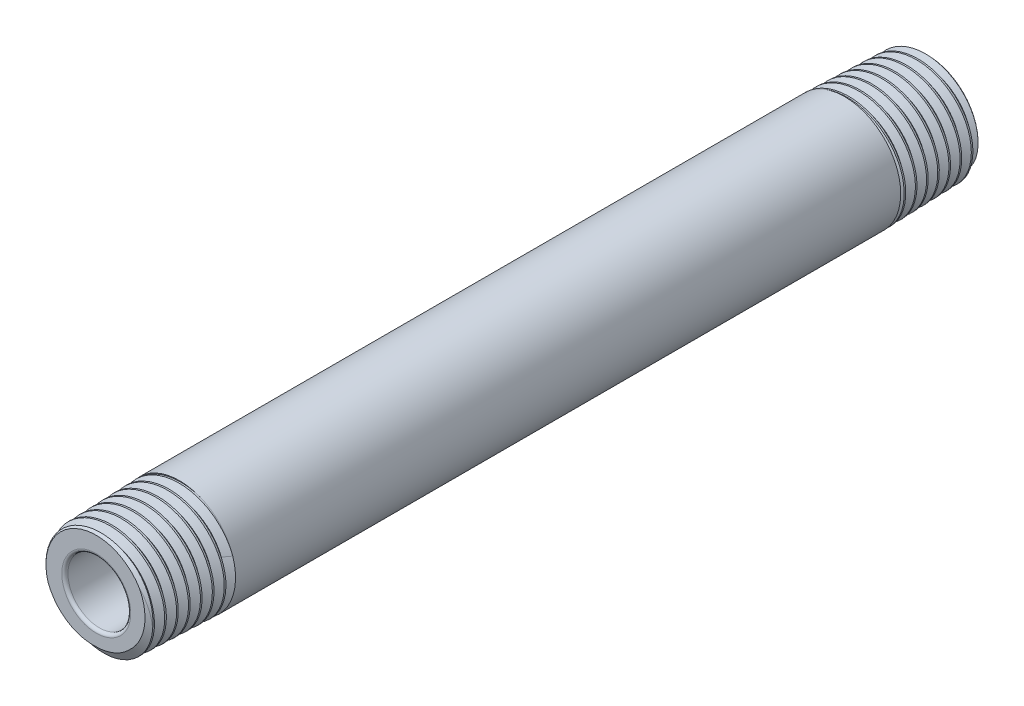
from build123d import *

# Parameters (mm, degrees)
CHAMFER1_SIZE       = 0.377825
CHAMFER1_SIZE2      = 0.390155618
FILLET1_R           = 0.377825
SKETCH6_R           = 6.858
BOSS_EXTRUDE1_DEPTH = 10.16
BOSS_EXTRUDE1_TAPER = 60
SKETCH7_R           = 3.8354
CUT_EXTRUDE1_DEPTH  = 52.717543841
CIRPATTERN1_COUNT   = 2


with BuildPart() as part:
    # Sketch2 → Revolve1 (revolve)
    with BuildSketch(Plane(origin=(0, 0, 0), x_dir=(0, 0, -1), z_dir=(1, 0, 0)), mode=Mode.PRIVATE) as revolve1_sk:
        Polygon((-50.8, 6.541667453), (-40.64, 6.858), (0, 6.858), (0, 3.8354), (-50.8, 3.8354), align=None)
    revolve(revolve1_sk.sketch.rotate(Axis((0, 0, 50.8), (0, 0, -1)), 90), axis=Axis((0, 0, 50.8), (0, 0, -1)))

    # Chamfer1
    chamfer1_edges = [part.edges().sort_by_distance(p)[0] for p in [
        (-6.541667453, 0, 50.8),
    ]]
    chamfer1_side = [part.faces().sort_by_distance(p)[0] for p in [
        (-6.699833727, 0, 45.72),
    ]]
    chamfer(chamfer1_edges, length=CHAMFER1_SIZE, length2=CHAMFER1_SIZE2, reference=chamfer1_side[0])

    # Fillet1
    fillet1_edges = [part.edges().sort_by_distance(p)[0] for p in [
        (-3.8354, 0, 50.8),
    ]]
    fillet(fillet1_edges, radius=FILLET1_R)

    # Mirror1: part across plane


with BuildPart() as part_1:
    add(part.part)
    add(part.part.mirror(Plane.XY))

    # SurfaceCut1
    split(bisect_by=Plane.XY, keep=Keep.TOP)


with BuildPart() as body_2:
    # Split1: the piece on the far side of the plane
    add(part_1.part)
    split(bisect_by=Plane.XY.offset(40.64), keep=Keep.BOTTOM)


with BuildPart() as part_2:
    add(part_1.part)

    # Split1
    split(bisect_by=Plane.XY.offset(40.64), keep=Keep.TOP)

    # Cut-Sweep1: sweep along a curve in space
    with BuildLine() as cut_sweep1_path:
        add(Edge.make_bspline(
            [(0, 6.541667453, 50.8), (0.877709824, 6.54260565, 50.769866898), (1.755426188, 6.36454889, 50.739733796), (3.371979301, 5.678320114, 50.679467593), (4.110112963, 5.170443033, 50.649334491), (5.329171692, 3.905254079, 50.589068287), (5.809565174, 3.148489228, 50.558935185), (6.435843944, 1.506162618, 50.498668981), (6.581454305, 0.621312709, 50.46853588), (6.514293191, -1.13584603, 50.408269676), (6.301547631, -2.007391876, 50.378136574), (5.551090642, -3.598488528, 50.31787037), (5.013702082, -4.317347184, 50.287737269), (3.699370211, -5.487801762, 50.227471065), (2.922995349, -5.938887116, 50.197337963), (1.254483374, -6.501167347, 50.137071759), (0.363069598, -6.612115039, 50.106938657), (-1.393109508, -6.475782942, 50.046672454), (-2.257112152, -6.228559105, 50.016539352), (-3.820197564, -5.414816609, 49.956273148), (-4.518600229, -4.848648353, 49.926140046), (-5.63846858, -3.487042596, 49.865873843), (-6.059445575, -2.692194167, 49.835740741), (-6.556635396, -0.999994035, 49.775474537), (-6.632629256, -0.103376076, 49.745341435), (-6.427099903, 1.649096883, 49.685075231), (-6.145662696, 2.504190681, 49.65494213), (-5.269679132, 4.036744925, 49.594675926), (-4.67551026, 4.713538412, 49.564542824), (-3.268579627, 5.780910407, 49.50427662), (-2.456426715, 6.171022937, 49.474143519), (-0.743081048, 6.602128049, 49.413877315), (0.15736866, 6.642930322, 49.383744213), (1.903405405, 6.368285053, 49.323478009), (2.748233908, 6.05295354, 49.293344907), (4.24777596, 5.115873787, 49.233078704), (4.901836774, 4.494529623, 49.202945602), (5.914877466, 3.044300325, 49.142679398), (6.273414878, 2.21604294, 49.112546296), (6.637540441, 0.484135954, 49.052280093), (6.642967332, -0.418762418, 49.022146991), (6.299395332, -2.155633579, 48.961880787), (5.950542417, -2.988851685, 48.931747685), (4.953610351, -4.452943436, 48.871481481), (4.305961329, -5.083179628, 48.84134838), (2.814533876, -6.040132368, 48.781082176), (1.971401186, -6.366430729, 48.750949074), (0.223554795, -6.662783093, 48.69068287), (-0.680400632, -6.632705236, 48.660549769), (-2.405381798, -6.22050361, 48.600283565), (-3.225657894, -5.838555639, 48.570150463), (-4.651908099, -4.783112521, 48.509884259), (-5.25726108, -4.110072979, 48.479751157), (-6.156450528, -2.579619152, 48.419484954), (-6.449893819, -1.722867659, 48.389351852), (-6.67778211, 0.038262492, 48.329085648), (-6.612124955, 0.941876983, 48.298952546), (-6.131698625, 2.652252983, 48.238686343), (-5.717134899, 3.458271065, 48.208553241), (-4.604617611, 4.84433924, 48.148287037), (-3.90714451, 5.423785548, 48.118153935), (-2.339904207, 6.263620563, 48.057887731), (-1.470815879, 6.523641801, 48.02775463), (0.30091269, 6.682479344, 47.967488426), (1.202784035, 6.581223457, 47.937355324), (2.895853203, 6.033084895, 47.87708912), (3.686314989, 5.586437102, 47.846956019), (5.029915236, 4.418376226, 47.786689815), (5.58246825, 3.697467799, 47.756556713), (6.361444662, 2.095745767, 47.696290509), (6.587526952, 1.215626119, 47.666157407), (6.676832539, -0.563989923, 47.605891204), (6.540013822, -1.462713871, 47.575758102), (5.924782611, -3.135792311, 47.515491898), (5.446634168, -3.909419327, 47.485358796), (4.224651908, -5.208324087, 47.425092593), (3.481346242, -5.733035696, 47.394959491), (1.847508697, -6.449738943, 47.334693287), (0.957684834, -6.641416456, 47.304560185), (-0.827086282, -6.660815453, 47.244293981), (-1.721258724, -6.488525269, 47.21416088), (-3.371684567, -5.806927495, 47.153894676), (-4.127220207, -5.297912817, 47.123761574), (-5.379263938, -4.023720777, 47.06349537), (-5.875226147, -3.259094322, 47.033362269), (-6.528333789, -1.595565458, 46.973096065), (-6.685192659, -0.697384073, 46.942962963), (-6.634417948, 1.089792458, 46.882696759), (-6.426803167, 1.978011621, 46.852563657), (-5.679670645, 3.603149251, 46.792297454), (-5.140474318, 4.339360818, 46.762164352), (-3.815871127, 5.542443584, 46.701898148), (-3.031037147, 6.008790068, 46.671765046), (-1.340295547, 6.597074161, 46.611498843), (-0.435120885, 6.718753304, 46.581365741), (1.35169838, 6.597646062, 46.521099537), (2.232567026, 6.354909017, 46.490966435), (3.829811285, 5.543178344, 46.430700231), (4.545491993, 4.974534231, 46.40056713), (5.697582959, 3.601403025, 46.340300926), (6.133490558, 2.797509982, 46.310167824), (6.655819886, 1.082084927, 46.24990162), (6.742011744, 0.171296711, 46.219768519), (6.550522053, -1.612393852, 46.159502315), (6.272920411, -2.484521474, 46.129369213), (5.397631855, -4.051301832, 46.069103009), (4.800322108, -4.745272777, 46.038969907), (3.380627875, -5.844413619, 45.978703704), (2.558857751, -6.249103764, 45.948570602), (0.821325443, -6.704445931, 45.888304398), (-0.093683227, -6.754897128, 45.858171296), (-1.871469198, -6.493084415, 45.797905093), (-2.733474212, -6.180930959, 45.767771991), (-4.267258899, -5.243227181, 45.707505787), (-4.938370996, -4.618081188, 45.677372685), (-5.982679194, -3.153867968, 45.617106481), (-6.355419274, -2.315434535, 45.58697338), (-6.742842643, -0.558414226, 45.526707176), (-6.757354565, 0.35941055, 45.496574074), (-6.425387878, 2.128515906, 45.43630787), (-6.0790502, 2.979027841, 45.406174769), (-5.080174809, 4.477327926, 45.345908565), (-4.428068052, 5.124463798, 45.315775463), (-2.921456015, 6.112135833, 45.255509259), (-2.067603042, 6.452240491, 45.225376157), (-0.293753093, 6.770915978, 45.165109954), (0.625474352, 6.749345262, 45.134976852), (2.383127268, 6.347503366, 45.074710648), (3.220788941, 5.96740348, 45.044577546), (4.681162363, 4.908699432, 44.984311343), (5.303238195, 4.230552272, 44.954178241), (6.232552626, 2.683734657, 44.893912037), (6.539384986, 1.815734071, 44.863778935), (6.788587694, 0.027747927, 44.803512731), (6.730846637, -0.891461835, 44.77337963), (6.259517949, -2.634899027, 44.713113426), (5.846131809, -3.458368707, 44.682980324), (4.729039636, -4.878424244, 44.62271412), (4.025816031, -5.474391586, 44.592581019), (2.441055964, -6.343712008, 44.532314815), (1.560205954, -6.616684832, 44.502181713), (-0.239191941, -6.795795529, 44.441915509), (-1.156958949, -6.701852412, 44.411782407), (-2.883430018, -6.161534754, 44.351516204), (-3.691383572, -5.715391691, 44.321383102), (-5.068784741, -4.541447578, 44.261116898), (-5.637632261, -3.814153717, 44.230983796), (-6.445410146, -2.193780911, 44.170717593), (-6.683986916, -1.301403992, 44.140584491), (-6.79249335, 0.506654363, 44.080318287), (-6.662372668, 1.421551037, 44.050185185), (-6.053672855, 3.128322804, 43.989918981), (-5.57535493, 3.919455822, 43.95978588), (-4.346188632, 5.25192471, 43.899519676), (-3.595871507, 5.792679897, 43.869386574), (-1.942278846, 6.537457302, 43.80912037), (-1.039719873, 6.74115322, 43.778987269), (0.774225013, 6.778651278, 43.718721065), (1.684823482, 6.612433893, 43.688587963), (3.369184312, 5.936067146, 43.628321759), (4.142214209, 5.426208412, 43.598188657), (5.427535223, 4.14354102, 43.537922454), (5.939266033, 3.371286925, 43.507789352), (6.619678173, 1.686926936, 43.447523148), (6.788061097, 0.775551078, 43.417390046), (6.754255787, -1.041488025, 43.357123843), (6.552078985, -1.946362356, 43.326990741), (5.808868172, -3.605626463, 43.266724537), (5.268153858, -4.359294555, 43.236591435), (3.933795415, -5.595318085, 43.176325231), (3.140728382, -6.07713453, 43.14619213), (1.428109601, -6.691912219, 43.085925926), (0.509300279, -6.824603505, 43.055792824), (-1.308026642, -6.719309782, 42.99552662), (-2.205755072, -6.481367245, 42.965393519), (-3.837266799, -5.672241951, 42.905127315), (-4.570340344, -5.101407562, 42.874994213), (-5.754986337, -3.717254528, 42.814728009), (-6.206042014, -2.904534693, 42.784594907), (-6.754013957, -1.166217939, 42.724328704), (-6.85068923, -0.241374724, 42.694195602), (-6.673832643, 1.573423863, 42.633929398), (-6.400374334, 2.462591036, 42.603796296), (-5.526369763, 4.063729095, 42.543530093), (-4.926200094, 4.775003303, 42.513396991), (-3.494232673, 5.90626474, 42.453130787), (-2.663054587, 6.325758293, 42.422997685), (-0.901649134, 6.805853243, 42.362731481), (0.027814386, 6.866243079, 42.33259838), (1.837263098, 6.617860253, 42.272332176), (2.71646229, 6.30919221, 42.242199074), (4.284643971, 5.371447914, 42.18193287), (4.972943979, 4.74277599, 42.151799769), (6.048890247, 3.265055312, 42.091533565), (6.436066767, 2.41664619, 42.061400463), (6.84731552, 0.63480585, 42.001134259), (6.871206049, -0.297852524, 41.971001157), (6.551444993, -2.099128822, 41.910734954), (6.207929035, -2.966964167, 41.880601852), (5.20768748, -4.499649494, 41.820335648), (4.551393413, -5.163832297, 41.790202546), (3.030058583, -6.18261245, 41.729936343), (2.165676493, -6.536764808, 41.699803241), (0.366095625, -6.878302053, 41.639537037), (-0.568322481, -6.865535475, 41.609403935), (-2.358607226, -6.474655714, 41.549137731), (-3.213695933, -6.096709059, 41.51900463), (-4.708391767, -5.035314021, 41.458738426), (-5.347348104, -4.352323791, 41.428605324), (-6.30719402, -2.789588808, 41.36833912), (-6.627664123, -1.910520807, 41.338206019), (-6.898730131, -0.095930242, 41.277939815), (-6.849205145, 0.838805009, 41.247806713), (-6.387577683, 2.615286874, 41.187540509), (-5.975672477, 3.456261422, 41.157407407), (-4.85456728, 4.91052551, 41.097141204), (-4.145851438, 5.523181708, 41.067008102), (-2.544001979, 6.422411112, 41.006741898), (-1.651562206, 6.708591095, 40.976608796), (0.175274896, 6.908533253, 40.916342593), (1.108879468, 6.8222054, 40.886209491), (2.868759351, 6.290312501, 40.825943287), (3.694269681, 5.844975265, 40.795810185), (5.105714628, 4.665700847, 40.735543981), (5.691034394, 3.932273148, 40.70541088), (6.52805377, 2.293663241, 40.645144676), (6.779387103, 1.389190947, 40.615011574), (6.90766128, -0.447101409, 40.55474537), (6.784543198, -1.378124484, 40.524612269), (6.182977999, -3.118619916, 40.464346065), (5.704788981, -3.927335589, 40.434212963), (4.468981813, -5.293632768, 40.373946759), (3.711897774, -5.850618927, 40.343813657), (2.03894634, -6.623926289, 40.283547454), (1.123803885, -6.839908819, 40.253414352), (-0.719128585, -6.896080569, 40.193148148), (-1.646118601, -6.736242158, 40.163015046), (-3.364468147, -6.065708105, 40.102748843), (-4.155080486, -5.555300548, 40.072615741), (-5.47396386, -4.264690389, 40.012349537), (-6.00166004, -3.485045778, 39.982216435), (-6.709847577, -1.780233075, 39.921950231), (-6.890028481, -0.855803872, 39.89181713), (-6.873774076, 0.990934029, 39.831550926), (-6.677342578, 1.912440949, 39.801417824), (-5.938652687, 3.605908578, 39.74115162), (-5.396712016, 4.377132781, 39.711018519), (-4.053119517, 5.646402645, 39.650752315), (-3.252048772, 6.143894902, 39.620619213), (-1.517912718, 6.78565148, 39.560353009), (-0.585599148, 6.929634143, 39.530219907), (1.26209432, 6.84074144, 39.469953704), (2.176671897, 6.607901424, 39.439820602), (3.842551341, 5.801977365, 39.379554398), (4.593128564, 5.229240287, 39.349421296), (5.810655191, 3.834574444, 39.289155093), (6.277073568, 3.013249031, 39.259021991), (6.564130329, 2.132815233, 39.228888889)],
            knots=[0, 0, 0, 0, 0.0078125, 0.0078125, 0.015625, 0.015625, 0.0234375, 0.0234375, 0.03125, 0.03125, 0.0390625, 0.0390625, 0.046875, 0.046875, 0.0546875, 0.0546875, 0.0625, 0.0625, 0.0703125, 0.0703125, 0.078125, 0.078125, 0.0859375, 0.0859375, 0.09375, 0.09375, 0.1015625, 0.1015625, 0.109375, 0.109375, 0.1171875, 0.1171875, 0.125, 0.125, 0.1328125, 0.1328125, 0.140625, 0.140625, 0.1484375, 0.1484375, 0.15625, 0.15625, 0.1640625, 0.1640625, 0.171875, 0.171875, 0.1796875, 0.1796875, 0.1875, 0.1875, 0.1953125, 0.1953125, 0.203125, 0.203125, 0.2109375, 0.2109375, 0.21875, 0.21875, 0.2265625, 0.2265625, 0.234375, 0.234375, 0.2421875, 0.2421875, 0.25, 0.25, 0.2578125, 0.2578125, 0.265625, 0.265625, 0.2734375, 0.2734375, 0.28125, 0.28125, 0.2890625, 0.2890625, 0.296875, 0.296875, 0.3046875, 0.3046875, 0.3125, 0.3125, 0.3203125, 0.3203125, 0.328125, 0.328125, 0.3359375, 0.3359375, 0.34375, 0.34375, 0.3515625, 0.3515625, 0.359375, 0.359375, 0.3671875, 0.3671875, 0.375, 0.375, 0.3828125, 0.3828125, 0.390625, 0.390625, 0.3984375, 0.3984375, 0.40625, 0.40625, 0.4140625, 0.4140625, 0.421875, 0.421875, 0.4296875, 0.4296875, 0.4375, 0.4375, 0.4453125, 0.4453125, 0.453125, 0.453125, 0.4609375, 0.4609375, 0.46875, 0.46875, 0.4765625, 0.4765625, 0.484375, 0.484375, 0.4921875, 0.4921875, 0.5, 0.5, 0.5078125, 0.5078125, 0.515625, 0.515625, 0.5234375, 0.5234375, 0.53125, 0.53125, 0.5390625, 0.5390625, 0.546875, 0.546875, 0.5546875, 0.5546875, 0.5625, 0.5625, 0.5703125, 0.5703125, 0.578125, 0.578125, 0.5859375, 0.5859375, 0.59375, 0.59375, 0.6015625, 0.6015625, 0.609375, 0.609375, 0.6171875, 0.6171875, 0.625, 0.625, 0.6328125, 0.6328125, 0.640625, 0.640625, 0.6484375, 0.6484375, 0.65625, 0.65625, 0.6640625, 0.6640625, 0.671875, 0.671875, 0.6796875, 0.6796875, 0.6875, 0.6875, 0.6953125, 0.6953125, 0.703125, 0.703125, 0.7109375, 0.7109375, 0.71875, 0.71875, 0.7265625, 0.7265625, 0.734375, 0.734375, 0.7421875, 0.7421875, 0.75, 0.75, 0.7578125, 0.7578125, 0.765625, 0.765625, 0.7734375, 0.7734375, 0.78125, 0.78125, 0.7890625, 0.7890625, 0.796875, 0.796875, 0.8046875, 0.8046875, 0.8125, 0.8125, 0.8203125, 0.8203125, 0.828125, 0.828125, 0.8359375, 0.8359375, 0.84375, 0.84375, 0.8515625, 0.8515625, 0.859375, 0.859375, 0.8671875, 0.8671875, 0.875, 0.875, 0.8828125, 0.8828125, 0.890625, 0.890625, 0.8984375, 0.8984375, 0.90625, 0.90625, 0.9140625, 0.9140625, 0.921875, 0.921875, 0.9296875, 0.9296875, 0.9375, 0.9375, 0.9453125, 0.9453125, 0.953125, 0.953125, 0.9609375, 0.9609375, 0.96875, 0.96875, 0.9765625, 0.9765625, 0.984375, 0.984375, 0.9921875, 0.9921875, 1, 1, 1, 1], degree=3))
    # Sketch4 → Cut-Sweep1 (sweep, cut)
    with BuildSketch(Plane(origin=(0, 0, 0), x_dir=(0, 0, -1), z_dir=(1, 0, 0))):
        Polygon((-51.505555556, 5.625123901), (-51.329166667, 5.625123901), (-50.711805556, 6.694424712), (-52.078819444, 6.618046082), align=None)
    sweep(path=cut_sweep1_path.line, is_frenet=True, mode=Mode.SUBTRACT)

    add(body_2.part)  # Boss-Extrude1 merges body 2
    # Sketch6 → Boss-Extrude1 (add, through all)
    with BuildSketch(Plane.XY.offset(40.64)):
        Circle(SKETCH6_R)
    extrude(amount=BOSS_EXTRUDE1_DEPTH, taper=BOSS_EXTRUDE1_TAPER)

    # Sketch7 → Cut-Extrude1 (cut, through all)
    with BuildSketch(Plane.XY):
        Circle(SKETCH7_R)
    extrude(amount=CUT_EXTRUDE1_DEPTH, mode=Mode.SUBTRACT)


with BuildPart() as cirpattern1_1:
    # CirPattern1: pattern copy
    add(part_2.part.rotate(Axis((0, 6.858, 0), (0, -1, 0)), 1 * 360 / CIRPATTERN1_COUNT))

    # Combine1: union part
    add(part_2.part)


solid = cirpattern1_1.part
